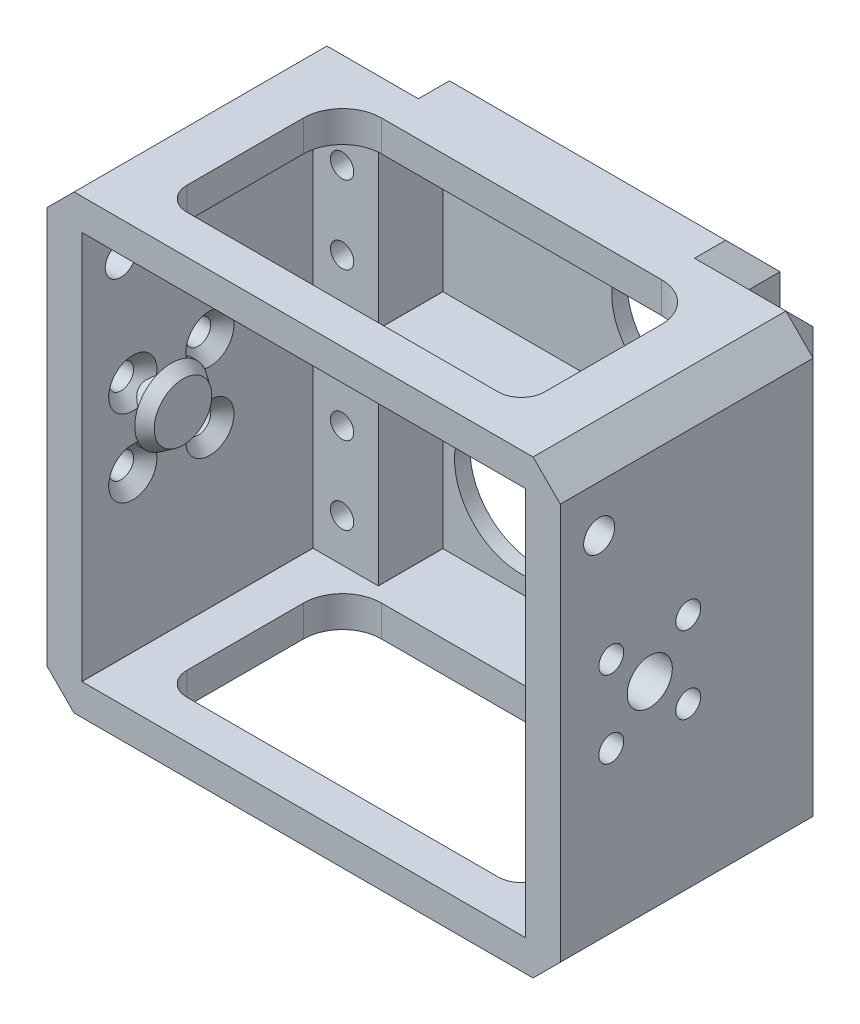
from build123d import *
from OCP.BRepFilletAPI import BRepFilletAPI_MakeChamfer

# Parameters (mm, degrees)
SKETCH1_W           = 57
SKETCH1_H           = 50
BOSS_EXTRUDE1_DEPTH = 2
SKETCH2_W           = 8.4
SKETCH2_H           = 50
BOSS_EXTRUDE2_DEPTH = 8.3
SKETCH3_R           = 1.5
CUT_EXTRUDE1_DEPTH  = 40.285366232
SKETCH4_W           = 40.2
SKETCH4_H           = 7.2
BOSS_EXTRUDE3_DEPTH = 30
SKETCH6_R           = 8.5
CUT_EXTRUDE3_DEPTH  = 49.345113507
SKETCH5_W           = 40.2
SKETCH5_H           = 22.25734796
CUT_EXTRUDE2_DEPTH  = 52.519025612
SKETCH7_W           = 66
SKETCH7_H           = 58
SKETCH7_W_2         = 57
SKETCH7_H_2         = 50
BOSS_EXTRUDE4_DEPTH = 40
SKETCH17_W          = 11.75
SKETCH17_H          = 58
CUT_EXTRUDE11_DEPTH = 4
FILLET1_SIZE        = 3.5
FILLET2_R           = 0.01
SKETCH8_W           = 46
SKETCH8_H           = 23
CUT_EXTRUDE4_DEPTH  = 5
SKETCH9_W           = 46
SKETCH9_H           = 23
CUT_EXTRUDE5_DEPTH  = 5
FILLET4_R           = 5
FILLET5_R           = 3
SKETCH10_R          = 2.9
SKETCH10_R_2        = 1.6
CUT_EXTRUDE6_DEPTH  = 83.443920334
SKETCH19_R          = 4.7
BOSS_EXTRUDE7_DEPTH = 1.5
BOSS_EXTRUDE8_START = 1.5
SKETCH20_R          = 4.7
BOSS_EXTRUDE8_DEPTH = 1.5
CHAMFER1_SIZE       = 1.5
FILLET3_SIZE        = 1.5
FILLET3_SIZE_2      = 1
SKETCH28_R          = 2
CUT_EXTRUDE14_DEPTH = 83.443920334
BOSS_EXTRUDE9_START = 0.55734796
BOSS_EXTRUDE9_DEPTH = 0.55734796


# Some blends are built 0.0001 mm under size
with BuildPart() as part:
    # Sketch1 → Boss-Extrude1 (new body)
    with BuildSketch(Plane.XY):
        Rectangle(SKETCH1_W, SKETCH1_H)
    extrude(amount=BOSS_EXTRUDE1_DEPTH)

    # Sketch2 → Boss-Extrude2 (add)
    with BuildSketch(Plane.XY.offset(2)):
        with Locations((-24.3, 0)):
            Rectangle(SKETCH2_W, SKETCH2_H)
        with Locations((24.3, 0)):
            Rectangle(SKETCH2_W, SKETCH2_H)
    extrude(amount=BOSS_EXTRUDE2_DEPTH)

    # Sketch3 → Cut-Extrude1 (cut, through all)
    with BuildSketch(Plane.XY.offset(10.3)):
        with Locations((-24.75, 19.5)):
            Circle(SKETCH3_R)
        with Locations((-24.75, 9.5)):
            Circle(SKETCH3_R)
        with Locations((-24.75, -9.5)):
            Circle(SKETCH3_R)
        with Locations((-24.75, -19.5)):
            Circle(SKETCH3_R)
        with Locations((24.75, -19.5)):
            Circle(SKETCH3_R)
        with Locations((24.75, -9.5)):
            Circle(SKETCH3_R)
        with Locations((24.75, 9.5)):
            Circle(SKETCH3_R)
        with Locations((24.75, 19.5)):
            Circle(SKETCH3_R)
    extrude(amount=-CUT_EXTRUDE1_DEPTH, mode=Mode.SUBTRACT)

    # Sketch4 → Boss-Extrude3 (add)
    with BuildSketch(Plane.XY.offset(2)):
        Rectangle(SKETCH4_W, SKETCH4_H)
    extrude(amount=BOSS_EXTRUDE3_DEPTH)

    # Sketch6 → Cut-Extrude3 (cut, through all)
    with BuildSketch(Plane.XY.offset(2)):
        with Locations((10.1, 14.3)):
            Circle(SKETCH6_R)
        with Locations((-10.1, -14.3)):
            Circle(SKETCH6_R)
    extrude(amount=-CUT_EXTRUDE3_DEPTH, mode=Mode.SUBTRACT)

    # Sketch5 → Cut-Extrude2 (cut, through all)
    with BuildSketch(Plane.XZ.offset(3.6)):
        with Locations((0, 20.87132602)):
            Rectangle(SKETCH5_W, SKETCH5_H)
    extrude(amount=-CUT_EXTRUDE2_DEPTH, mode=Mode.SUBTRACT)

    # Sketch7 → Boss-Extrude4 (add)
    with BuildSketch(Plane(origin=(0, 0, 0), x_dir=(-1, 0, 0), z_dir=(0, 0, -1))):
        Rectangle(SKETCH7_W, SKETCH7_H)
        Rectangle(SKETCH7_W_2, SKETCH7_H_2, mode=Mode.SUBTRACT)
    extrude(amount=-BOSS_EXTRUDE4_DEPTH)

    # Sketch17 → Cut-Extrude11 (cut)
    with BuildSketch(Plane(origin=(0, 0, 0), x_dir=(-1, 0, 0), z_dir=(0, 0, -1))):
        with Locations((-27.125, 0)):
            Rectangle(SKETCH17_W, SKETCH17_H)
        with Locations((27.125, 0)):
            Rectangle(SKETCH17_W, SKETCH17_H)
    extrude(amount=-CUT_EXTRUDE11_DEPTH, mode=Mode.SUBTRACT)

    # Fillet1
    fillet1_edges = [part.edges().sort_by_distance(p)[0] for p in [
        (-33, -29, 22),
        (33, -29, 22),
        (33, 29, 22),
        (-33, 29, 22),
        (0, 29, 0),
        (0, -29, 0),
        (33, 0, 4),
        (27.125, 29, 4),
        (21.25, 29, 2),
        (27.125, -29, 4),
        (21.25, -29, 2),
        (-33, 0, 4),
        (-27.125, -29, 4),
        (-21.25, -29, 2),
        (-27.125, 29, 4),
        (-21.25, 29, 2),
    ]]
    chamfer(fillet1_edges, length=FILLET1_SIZE)

    # Fillet2
    fillet2_edges = [part.edges().sort_by_distance(p)[0] for p in [
        (20.1, -3.6, 5.87132602),
        (-20.1, -3.6, 5.87132602),
        (-20.1, 3.6, 5.87132602),
        (28.5, 25, 25.15),
        (28.5, -25, 25.15),
        (-28.5, -25, 25.15),
        (-28.5, 25, 25.15),
        (-20.1, -25, 6.15),
        (-20.1, 25, 6.15),
        (20.1, 25, 6.15),
        (20.1, -25, 6.15),
    ]]
    fillet(fillet2_edges, radius=FILLET2_R)

    # Sketch8 → Cut-Extrude4 (cut)
    with BuildSketch(Plane(origin=(0, 29, 0), x_dir=(1, 0, 0), z_dir=(0, 1, 0))):
        with Locations((0, -23.5)):
            Rectangle(SKETCH8_W, SKETCH8_H)
    extrude(amount=-CUT_EXTRUDE4_DEPTH, mode=Mode.SUBTRACT)

    # Sketch9 → Cut-Extrude5 (cut)
    with BuildSketch(Plane.XZ.offset(29)):
        with Locations((0, 23.5)):
            Rectangle(SKETCH9_W, SKETCH9_H)
    extrude(amount=-CUT_EXTRUDE5_DEPTH, mode=Mode.SUBTRACT)

    # Fillet4
    fillet4_edges = [part.edges().sort_by_distance(p)[0] for p in [
        (-23, 27, 12),
        (23, 27, 12),
        (-23, -27, 12),
        (23, -27, 12),
    ]]
    fillet(fillet4_edges, radius=FILLET4_R)

    # Fillet5
    fillet5_edges = [part.edges().sort_by_distance(p)[0] for p in [
        (-23, 27, 35),
        (23, 27, 35),
        (-23, -27, 35),
        (23, -27, 35),
    ]]
    fillet(fillet5_edges, radius=FILLET5_R)

    # Sketch10 → Cut-Extrude6 (cut, through all)
    with BuildSketch(Plane(origin=(33, 0, 0), x_dir=(0, 0, -1), z_dir=(1, 0, 0))):
        with Locations((-28.5, 0)):
            Circle(SKETCH10_R)
        with Locations((-33.45, 4.95)):
            Circle(SKETCH10_R_2)
        with Locations((-23.55, 4.95)):
            Circle(SKETCH10_R_2)
        with Locations((-23.55, -4.95)):
            Circle(SKETCH10_R_2)
        with Locations((-33.45, -4.95)):
            Circle(SKETCH10_R_2)
    extrude(amount=-CUT_EXTRUDE6_DEPTH, mode=Mode.SUBTRACT)

    # Sketch19 → Boss-Extrude7 (add)
    with BuildSketch(Plane(origin=(-28.5, 0, 0), x_dir=(0, 0, -1), z_dir=(1, 0, 0))):
        with Locations(Location((-28.5, 0, 0), (0, 0, 180))):
            Circle(SKETCH19_R)
    extrude(amount=BOSS_EXTRUDE7_DEPTH)

    # Sketch20 → Boss-Extrude8 (add)
    with BuildSketch(Plane.ZY.offset(-28.5).offset(BOSS_EXTRUDE8_START)):
        with Locations((28.5, 0)):
            Circle(SKETCH20_R)
    extrude(amount=-BOSS_EXTRUDE8_DEPTH)

    # Chamfer1
    # the kernel refuses this chamfer: 1.5 mm, written as the material it takes off along each edge
    with BuildSketch(Plane(origin=(28.5, 4.95, 33.45), x_dir=(0, 0, -1), z_dir=(0, -1, 0))) as chamfer1_piece_1_section:
        Polygon((1.6 + CHAMFER1_SIZE, 0), (1.6, CHAMFER1_SIZE), (1.6, 0), align=None)
    chamfer1_piece_1 = revolve(axis=Axis((28.5, 4.95, 33.45), (1, 0, 0)), mode=Mode.PRIVATE)
    chamfer1_piece_1 = chamfer1_piece_1 - Plane(origin=(29.232320386, 0, 28.5), x_dir=(0, 0, 1), z_dir=(-1, 0, 0)) * Cylinder(4.7, 13, mode=Mode.PRIVATE)
    add(chamfer1_piece_1, mode=Mode.SUBTRACT)
    with BuildSketch(Plane(origin=(-28.5, 4.95, 33.45), x_dir=(0, 0, -1), z_dir=(0, -1, 0))) as chamfer1_piece_2_section:
        Polygon((1.6 + CHAMFER1_SIZE, 0), (1.6, -CHAMFER1_SIZE), (1.6, 0), align=None)
    chamfer1_piece_2 = revolve(axis=Axis((-28.5, 4.95, 33.45), (1, 0, 0)), mode=Mode.PRIVATE)
    chamfer1_piece_2 = chamfer1_piece_2 - Plane(origin=(-29.232320373, 0, 28.5), x_dir=(0, 0, 1), z_dir=(-1, 0, 0)) * Cylinder(4.7, 13, mode=Mode.PRIVATE)
    add(chamfer1_piece_2, mode=Mode.SUBTRACT)
    with BuildSketch(Plane(origin=(28.5, -4.95, 23.55), x_dir=(0, 0, -1), z_dir=(0, -1, 0))) as chamfer1_piece_3_section:
        Polygon((1.6 + CHAMFER1_SIZE, 0), (1.6, CHAMFER1_SIZE), (1.6, 0), align=None)
    chamfer1_piece_3 = revolve(axis=Axis((28.5, -4.95, 23.55), (1, 0, 0)), mode=Mode.PRIVATE)
    chamfer1_piece_3 = chamfer1_piece_3 - Plane(origin=(29.232320385, 0, 28.5), x_dir=(0, 0, 1), z_dir=(-1, 0, 0)) * Cylinder(4.7, 13, mode=Mode.PRIVATE)
    add(chamfer1_piece_3, mode=Mode.SUBTRACT)
    with BuildSketch(Plane(origin=(-28.5, -4.95, 23.55), x_dir=(0, 0, -1), z_dir=(0, -1, 0))) as chamfer1_piece_4_section:
        Polygon((1.6 + CHAMFER1_SIZE, 0), (1.6, -CHAMFER1_SIZE), (1.6, 0), align=None)
    chamfer1_piece_4 = revolve(axis=Axis((-28.5, -4.95, 23.55), (1, 0, 0)), mode=Mode.PRIVATE)
    chamfer1_piece_4 = chamfer1_piece_4 - Plane(origin=(-29.232320379, 0, 28.5), x_dir=(0, 0, 1), z_dir=(-1, 0, 0)) * Cylinder(4.7, 13, mode=Mode.PRIVATE)
    add(chamfer1_piece_4, mode=Mode.SUBTRACT)
    with BuildSketch(Plane(origin=(28.5, 4.95, 23.55), x_dir=(0, 0, -1), z_dir=(0, -1, 0))) as chamfer1_piece_5_section:
        Polygon((1.6 + CHAMFER1_SIZE, 0), (1.6, CHAMFER1_SIZE), (1.6, 0), align=None)
    chamfer1_piece_5 = revolve(axis=Axis((28.5, 4.95, 23.55), (1, 0, 0)), mode=Mode.PRIVATE)
    chamfer1_piece_5 = chamfer1_piece_5 - Plane(origin=(29.232320386, 0, 28.5), x_dir=(0, 0, 1), z_dir=(-1, 0, 0)) * Cylinder(4.7, 13, mode=Mode.PRIVATE)
    add(chamfer1_piece_5, mode=Mode.SUBTRACT)
    with BuildSketch(Plane(origin=(-28.5, 4.95, 23.55), x_dir=(0, 0, -1), z_dir=(0, -1, 0))) as chamfer1_piece_6_section:
        Polygon((1.6 + CHAMFER1_SIZE, 0), (1.6, -CHAMFER1_SIZE), (1.6, 0), align=None)
    chamfer1_piece_6 = revolve(axis=Axis((-28.5, 4.95, 23.55), (1, 0, 0)), mode=Mode.PRIVATE)
    chamfer1_piece_6 = chamfer1_piece_6 - Plane(origin=(-29.23232037, 0, 28.5), x_dir=(0, 0, 1), z_dir=(-1, 0, 0)) * Cylinder(4.7, 13, mode=Mode.PRIVATE)
    add(chamfer1_piece_6, mode=Mode.SUBTRACT)
    with BuildSketch(Plane(origin=(28.5, -4.95, 33.45), x_dir=(0, 0, -1), z_dir=(0, -1, 0))) as chamfer1_piece_7_section:
        Polygon((1.6 + CHAMFER1_SIZE, 0), (1.6, CHAMFER1_SIZE), (1.6, 0), align=None)
    chamfer1_piece_7 = revolve(axis=Axis((28.5, -4.95, 33.45), (1, 0, 0)), mode=Mode.PRIVATE)
    chamfer1_piece_7 = chamfer1_piece_7 - Plane(origin=(29.232320384, 0, 28.5), x_dir=(0, 0, 1), z_dir=(-1, 0, 0)) * Cylinder(4.7, 13, mode=Mode.PRIVATE)
    add(chamfer1_piece_7, mode=Mode.SUBTRACT)
    with BuildSketch(Plane(origin=(-28.5, -4.95, 33.45), x_dir=(0, 0, -1), z_dir=(0, -1, 0))) as chamfer1_piece_8_section:
        Polygon((1.6 + CHAMFER1_SIZE, 0), (1.6, -CHAMFER1_SIZE), (1.6, 0), align=None)
    chamfer1_piece_8 = revolve(axis=Axis((-28.5, -4.95, 33.45), (1, 0, 0)), mode=Mode.PRIVATE)
    chamfer1_piece_8 = chamfer1_piece_8 - Plane(origin=(-29.232320383, 0, 28.5), x_dir=(0, 0, 1), z_dir=(-1, 0, 0)) * Cylinder(4.7, 13, mode=Mode.PRIVATE)
    add(chamfer1_piece_8, mode=Mode.SUBTRACT)

    # Fillet3
    fillet3_edges_1 = [part.edges().sort_by_distance(p)[0] for p in [
        (-27, 0, 23.8),
    ]]
    fillet3_side_1 = [part.faces().sort_by_distance(p)[0] for p in [
        (-27.02, 0, 23.8),
    ]]
    fillet3_edges_2 = [part.edges().sort_by_distance(p)[0] for p in [
        (27, 0, 23.8),
    ]]
    fillet3_side_2 = [part.faces().sort_by_distance(p)[0] for p in [
        (27.02, 0, 23.8),
    ]]
    fillet3 = BRepFilletAPI_MakeChamfer(part.part.solid().wrapped)
    for e in fillet3_edges_1:
        fillet3.Add(FILLET3_SIZE - 0.0001, FILLET3_SIZE_2 - 0.0001, e.wrapped, fillet3_side_1[0].wrapped)
    for e in fillet3_edges_2:
        fillet3.Add(FILLET3_SIZE - 0.0001, FILLET3_SIZE_2 - 0.0001, e.wrapped, fillet3_side_2[0].wrapped)
    add(Compound.cast(fillet3.Shape()), mode=Mode.REPLACE)  # a hair under: the kernel refuses the full size

    # Sketch28 → Cut-Extrude14 (cut, through all)
    with BuildSketch(Plane.ZY.offset(33)):
        with Locations((35, 19.5)):
            Circle(SKETCH28_R)
    extrude(amount=-CUT_EXTRUDE14_DEPTH, mode=Mode.SUBTRACT)

    # Sketch29 → Boss-Extrude9 (add)
    with BuildSketch(Plane.XY.offset(9.74265204).offset(BOSS_EXTRUDE9_START)):
        with BuildLine():
            Line((-20.1, 3.61), (-20.1, -3.61))
            ThreePointArc((-20.1, -3.61), (-20.097071068, -3.602928932), (-20.09, -3.6))
            Line((-20.09, -3.6), (20.09, -3.6))
            ThreePointArc((20.09, -3.6), (20.097071068, -3.602928932), (20.1, -3.61))
            Line((20.1, -3.61), (20.1, 3.6))
            Line((20.1, 3.6), (-20.09, 3.6))
            ThreePointArc((-20.09, 3.6), (-20.097071068, 3.602928932), (-20.1, 3.61))
        make_face()
    extrude(amount=-BOSS_EXTRUDE9_DEPTH)


solid = part.part
